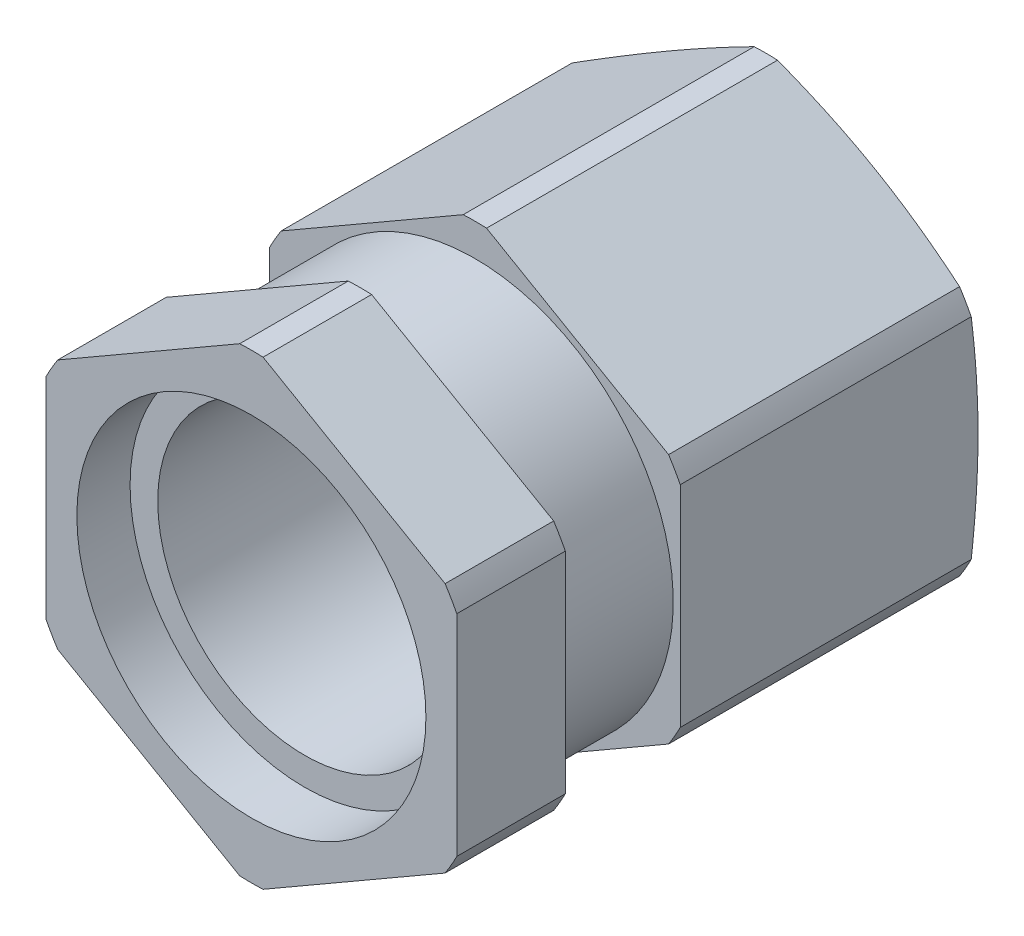
from build123d import *

# Parameters (mm, degrees)
SKETCH2_OUTSIDE_W = 16.808
SKETCH2_OUTSIDE_H = 16.808
EXTRUDE2_DEPTH    = 15.748315158


with BuildPart() as part:
    # Sketch1 → Revolve1 (revolve)
    with BuildSketch(Plane(origin=(0, 0, 0), x_dir=(0, 0, -1), z_dir=(1, 0, 0))):
        Polygon((0, 0), (0, 3.5), (-0.514462449, 5.42), (-7.35, 5.42), (-7.35, 4.66), (-10.05, 4.66), (-10.05, 5.42), (-12.6, 5.42), (-12.6, 4.1), (-11.35, 4.1), (-11.35, 3.45), (-6.5, 3.45), (-6.5, 1.5), (-4.801290929, 1.5), (-3.9, 0), align=None)
    revolve(axis=Axis((0, 0, 0), (0, 0, 1)))

    # Sketch2 outside → Extrude2 (cut, through all)
    with BuildSketch(Plane(origin=(0, 0, 0), x_dir=(-1, 0, 0), z_dir=(0, 0, -1))):
        Rectangle(SKETCH2_OUTSIDE_W, SKETCH2_OUTSIDE_H)
        Polygon((4.825, 2.785715049), (0, 5.571430098), (-4.825, 2.785715049), (-4.825, -2.785715049), (0, -5.571430098), (4.825, -2.785715049), align=None, mode=Mode.SUBTRACT)
    extrude(amount=-EXTRUDE2_DEPTH, mode=Mode.SUBTRACT)


solid = part.part
